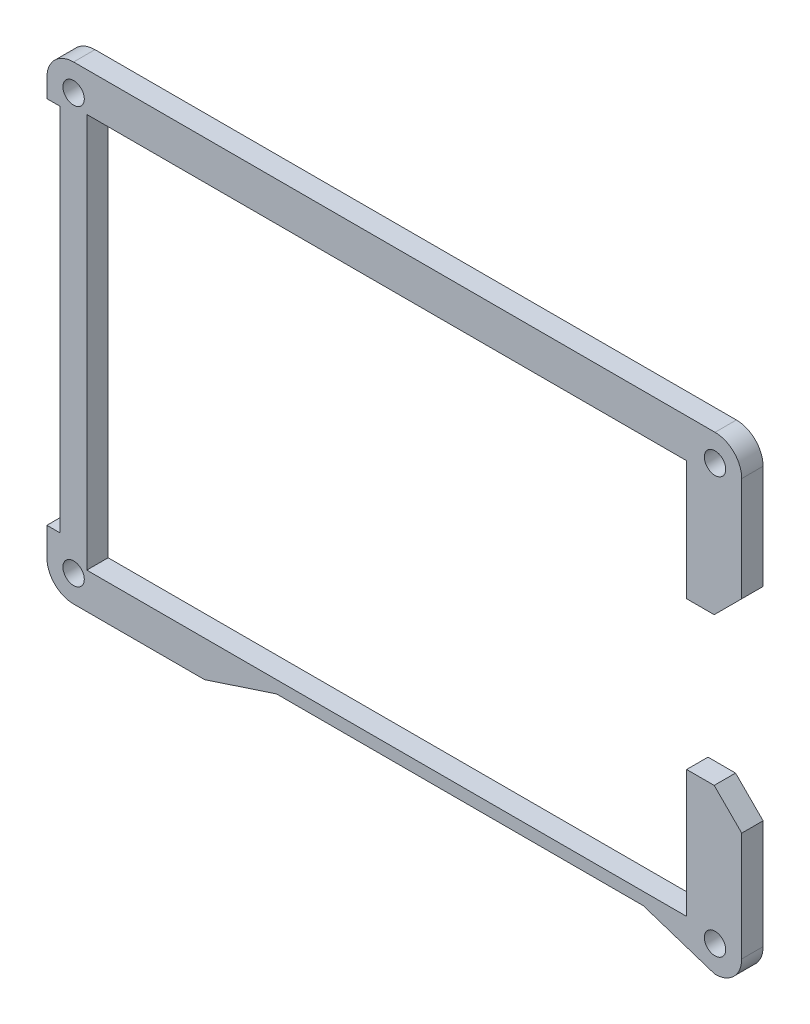
from build123d import *

# Parameters (mm, degrees)
SKETCH1_R           = 1.3462
BOSS_EXTRUDE1_DEPTH = 3.048
SKETCH2_R           = 1.524
CUT_EXTRUDE1_DEPTH  = 430.898988368
CUT_EXTRUDE2_DEPTH  = 430.898988368


with BuildPart() as part:
    # Sketch1 → Boss-Extrude1 (new body)
    with BuildSketch(Plane.XY):
        with BuildLine():
            Line((-401.0571, 150.956597849), (-401.0571, 148.341))
            Line((-401.0571, 148.341), (-399.1521, 148.341))
            Line((-399.1521, 148.341), (-399.1521, 95.6449))
            Line((-399.1521, 95.6449), (-401.0571, 95.6449))
            Line((-401.0571, 95.6449), (-401.0571, 91.659304166))
            ThreePointArc((-401.0571, 91.659304166), (-399.951018769, 88.947400452), (-397.2472, 87.8217))
            Line((-397.2472, 87.8217), (-378.5565, 87.8217))
            Line((-378.5565, 87.8217), (-368.3165, 91.1883))
            Line((-368.3165, 91.1883), (-315.9973, 91.1883))
            Line((-315.9973, 91.1883), (-305.7573, 87.8217))
            ThreePointArc((-305.7573, 87.8217), (-303.063223164, 88.937623164), (-301.9473, 91.6317))
            Line((-301.9473, 91.6317), (-301.9473, 111.74645))
            Line((-301.9473, 111.74645), (-305.87795, 115.6771))
            Line((-305.87795, 115.6771), (-309.8086, 115.6771))
            Line((-309.8086, 115.6771), (-309.8086, 92.9525))
            Line((-309.8086, 92.9525), (-395.3675, 92.9525))
            Line((-395.3675, 92.9525), (-395.3675, 149.2432))
            Line((-395.3675, 149.2432), (-309.8086, 149.2432))
            Line((-309.8086, 149.2432), (-309.8086, 128.8851))
            Line((-309.8086, 128.8851), (-305.87795, 128.8851))
            Line((-305.87795, 128.8851), (-301.9473, 132.81575))
            Line((-301.9473, 132.81575), (-301.9473, 150.9704))
            ThreePointArc((-301.9473, 150.9704), (-303.063223164, 153.664476836), (-305.7573, 154.7804))
            Line((-305.7573, 154.7804), (-397.247125, 154.7804))
            ThreePointArc((-397.247125, 154.7804), (-399.946077222, 153.659592612), (-401.0571, 150.956597849))
        make_face()
        with Locations((-397.247125, 150.9704)):
            Circle(SKETCH1_R, mode=Mode.SUBTRACT)
        with Locations((-305.7573, 150.9704)):
            Circle(SKETCH1_R, mode=Mode.SUBTRACT)
        with Locations((-305.7573, 91.6317)):
            Circle(SKETCH1_R, mode=Mode.SUBTRACT)
        with Locations((-397.2472, 91.6317)):
            Circle(SKETCH1_R, mode=Mode.SUBTRACT)
    extrude(amount=BOSS_EXTRUDE1_DEPTH)

    # Sketch2 → Cut-Extrude1 (cut, through all)
    with BuildSketch(Plane(origin=(0, 0, 0), x_dir=(-1, 0, 0), z_dir=(0, 0, -1))):
        with Locations((305.7573, 150.9704)):
            Circle(SKETCH2_R)
        with Locations((305.7573, 91.6317)):
            Circle(SKETCH2_R)
        with Locations((397.2472, 91.6317)):
            Circle(SKETCH2_R)
        with Locations((397.247125, 150.9704)):
            Circle(SKETCH2_R)
    extrude(amount=-CUT_EXTRUDE1_DEPTH, mode=Mode.SUBTRACT)

    # Sketch3 → Cut-Extrude2 (cut, through all)
    with BuildSketch(Plane.XY.offset(3.048)):
        Polygon((-309.8086, 132.1871), (-309.8086, 128.8851), (-305.87795, 128.8851), (-301.9473, 132.81575), (-301.9473, 136.11775), (-305.87795, 132.1871), align=None)
        Polygon((-305.87795, 115.6771), (-309.8086, 115.6771), (-309.8086, 111.1051), (-305.87795, 111.1051), (-301.9473, 107.17445), (-301.9473, 111.74645), align=None)
    extrude(amount=-CUT_EXTRUDE2_DEPTH, mode=Mode.SUBTRACT)


solid = part.part
